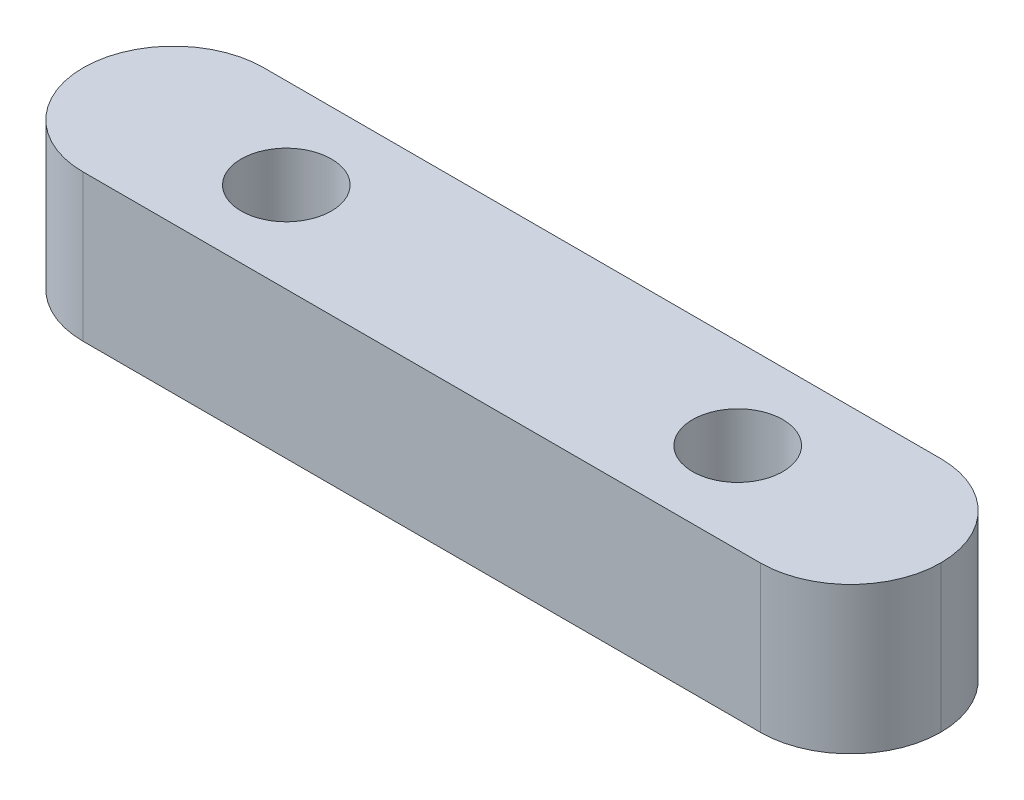
from build123d import *

# Parameters (mm, degrees)
ESBO_O1_W                = 38
ESBO_O1_H                = 8
ESBO_O1_R                = 2
RESSALTO_EXTRUS_O1_DEPTH = 3.25
FILETE1_R                = 4


with BuildPart() as part:
    # Esboço1 → Ressalto-extrusão1 (new, symmetric)
    with BuildSketch(Plane(origin=(0, 0, 0), x_dir=(1, 0, 0), z_dir=(0, 1, 0))):
        Rectangle(ESBO_O1_W, ESBO_O1_H)
        with Locations(Location((-10, 0, 0), (0, 0, 90))):
            Circle(ESBO_O1_R, mode=Mode.SUBTRACT)
        with Locations(Location((10, 0, 0), (0, 0, 90))):
            Circle(ESBO_O1_R, mode=Mode.SUBTRACT)
    extrude(amount=RESSALTO_EXTRUS_O1_DEPTH, both=True)

    # Filete1
    filete1_edges = [part.edges().sort_by_distance(p)[0] for p in [
        (-19, 0, 4),
        (-19, 0, -4),
        (19, 0, -4),
        (19, 0, 4),
    ]]
    fillet(filete1_edges, radius=FILETE1_R - 0.0001)  # a hair under: the kernel refuses the full size


solid = part.part
